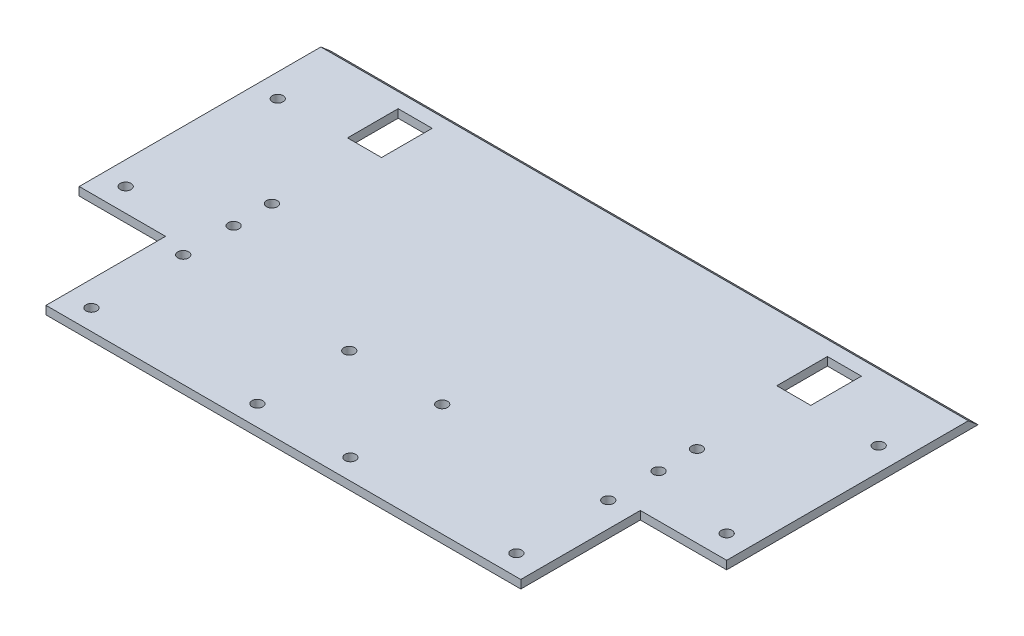
from build123d import *

# Parameters (mm, degrees)
CROQUIS1_R              = 1.625
CUERPO_INICIAL_DEPTH    = 2.5
SALIENTE_EXTRUIR2_DEPTH = 195
CROQUIS7_R              = 1.625
CORTAR_EXTRUIR2_DEPTH   = 10
CROQUIS10_R             = 1.625
CORTAR_EXTRUIR7_DEPTH   = 10
CROQUIS11_W             = 10.25
CROQUIS11_H             = 15.25
CORTAR_EXTRUIR8_DEPTH   = 10


with BuildPart() as part:
    # Croquis1 → Cuerpo Inicial (new body)
    with BuildSketch(Plane(origin=(0, 0, 0), x_dir=(1, 0, 0), z_dir=(0, 1, 0))):
        Polygon((-71.5, -25), (-71.5, -61), (71.5, -61), (71.5, -25), (97.5, -25), (97.5, 0), (97.5, 1), (97.5, 5.7), (45, 5.7), (-45, 5.7), (-97.5, 5.7), (-97.5, 1), (-97.5, 0), (-97.5, -25), align=None)
        with Locations(Location((-90.5, -18, 0), (0, 0, 270))):
            Circle(CROQUIS1_R, mode=Mode.SUBTRACT)
        with Locations(Location((90.5, -18, 0), (0, 0, 270))):
            Circle(CROQUIS1_R, mode=Mode.SUBTRACT)
    extrude(amount=CUERPO_INICIAL_DEPTH)

    # Croquis3 → Saliente-Extruir2 (add)
    with BuildSketch(Plane(origin=(97.5, 0, 0), x_dir=(0, 0, -1), z_dir=(1, 0, 0))):
        Polygon((5.7, 2.5), (47.783199952, 2.5), (50.7, 0), (5.7, 0), align=None)
    extrude(amount=-SALIENTE_EXTRUIR2_DEPTH)

    # Croquis7 → Cortar-Extruir2 (cut)
    with BuildSketch(Plane(origin=(0, 2.5, 0), x_dir=(1, 0, 0), z_dir=(0, 1, 0))):
        with Locations(Location((90.5, 27.783199952, 0), (0, 0, 270))):
            Circle(CROQUIS7_R)
        with Locations(Location((-90.5, 27.783199952, 0), (0, 0, 270))):
            Circle(CROQUIS7_R)
    extrude(amount=-CORTAR_EXTRUIR2_DEPTH, mode=Mode.SUBTRACT)

    # Croquis10 → Cortar-Extruir7 (cut)
    with BuildSketch(Plane(origin=(0, 2.5, -2.5), x_dir=(1, 0, 0), z_dir=(0, -1, 0))):
        with Locations(Location((64, 2.96, 0), (0, 0, 90))):
            Circle(CROQUIS10_R)
        with Locations(Location((64, 14.5, 0), (0, 0, 90))):
            Circle(CROQUIS10_R)
        with Locations(Location((-64, 2.96, 0), (0, 0, 90))):
            Circle(CROQUIS10_R)
        with Locations(Location((-64, 14.5, 0), (0, 0, 90))):
            Circle(CROQUIS10_R)
        with Locations(Location((64, 29.6754, 0), (0, 0, 90))):
            Circle(CROQUIS10_R)
        with Locations(Location((64, 57.3245, 0), (0, 0, 90))):
            Circle(CROQUIS10_R)
        with Locations(Location((-64, 57.3245, 0), (0, 0, 90))):
            Circle(CROQUIS10_R)
        with Locations(Location((-64, 29.6754, 0), (0, 0, 90))):
            Circle(CROQUIS10_R)
        with Locations(Location((14, 29.6754, 0), (0, 0, 90))):
            Circle(CROQUIS10_R)
        with Locations(Location((14, 57.3245, 0), (0, 0, 90))):
            Circle(CROQUIS10_R)
        with Locations(Location((-14, 57.3245, 0), (0, 0, 90))):
            Circle(CROQUIS10_R)
        with Locations(Location((-14, 29.6754, 0), (0, 0, 90))):
            Circle(CROQUIS10_R)
    extrude(amount=CORTAR_EXTRUIR7_DEPTH, mode=Mode.SUBTRACT)

    # Croquis11 → Cortar-Extruir8 (cut)
    with BuildSketch(Plane.XZ):
        with Locations((-64.64307361, -35.7)):
            Rectangle(CROQUIS11_W, CROQUIS11_H)
        with Locations((64.64307361, -35.7)):
            Rectangle(CROQUIS11_W, CROQUIS11_H)
    extrude(amount=-CORTAR_EXTRUIR8_DEPTH, mode=Mode.SUBTRACT)


solid = part.part
